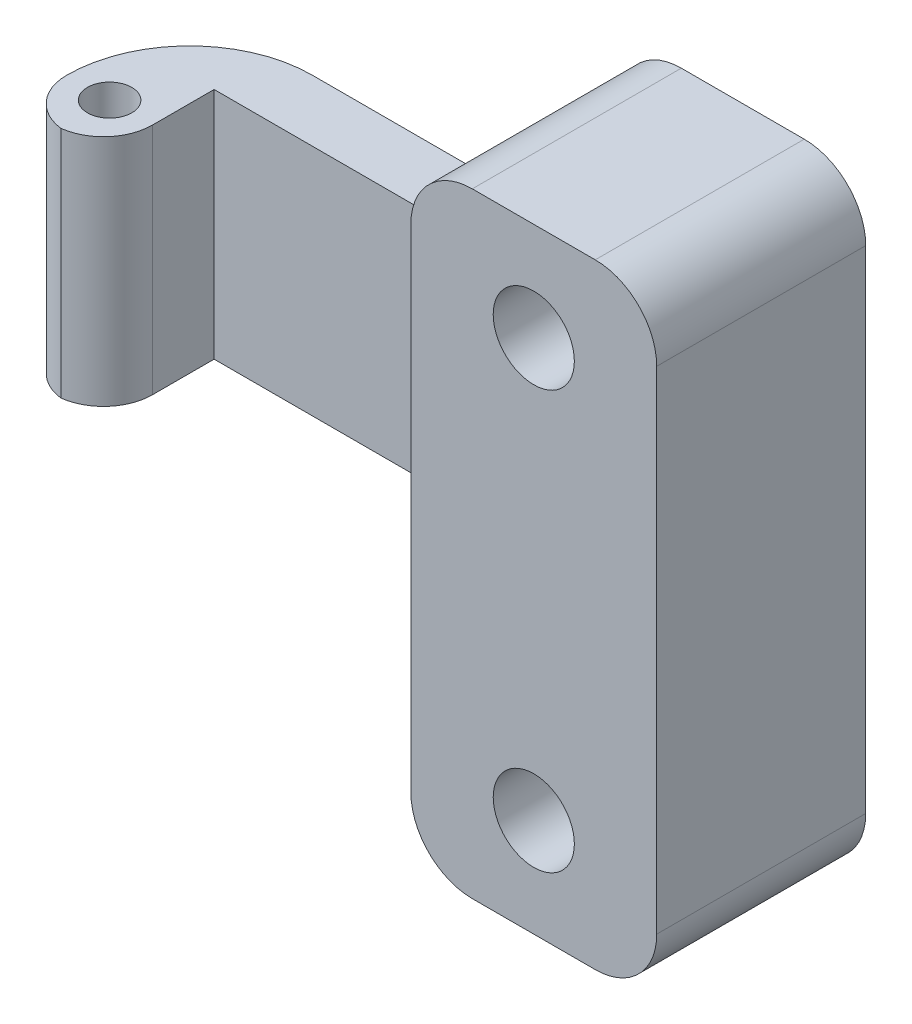
from build123d import *

# Parameters (mm, degrees)
BASE_SKETCH_W           = 35
BASE_SKETCH_H           = 19
BASE_DEPTH              = 5
HINGE_SKETCH_W          = 7
HINGE_SKETCH_H          = 19
HINGE_BODY_DEPTH        = 9
HINGE_HOLE_D            = 3.6
DOOR_BODY_SKETCH_W      = 20
DOOR_BODY_SKETCH_H      = 50
DOOR_BODY_DEPTH         = 12
DOOR_SCREWS_D           = 6.6
DOOR_SCREWS_CBORE_D     = 11
DOOR_SCREWS_CBORE_DEPTH = 6.4
HINGE_ROUND_R           = 3.99
HINGE_BODY_ROUND_R      = 10
DOOR_CORNERS_ROUND_R    = 5
DOOR_BODY_LINE_R        = 3


with BuildPart() as part:
    # Base sketch → Base (new body)
    with BuildSketch(Plane.XY):
        Rectangle(BASE_SKETCH_W, BASE_SKETCH_H)
        Polygon((17.5, 25), (17.5, 9.5), (17.5, -9.5), (17.5, -25), (37.5, -25), (37.5, 25), align=None)
    extrude(amount=BASE_DEPTH)

    # Hinge sketch → Hinge body (add)
    with BuildSketch(Plane.XY.offset(5)):
        with Locations((-14, 0)):
            Rectangle(HINGE_SKETCH_W, HINGE_SKETCH_H)
    extrude(amount=HINGE_BODY_DEPTH)

    # Hinge hole (through all)
    with Locations(Plane(origin=(0, -9.5, 0), x_dir=(-1, 0, 0), z_dir=(0, -1, 0))):
        with Locations((14, -10)):
            Hole(HINGE_HOLE_D / 2)

    # Door body sketch → Door body (add)
    with BuildSketch(Plane.XY.offset(5)):
        with Locations((27.5, 0)):
            Rectangle(DOOR_BODY_SKETCH_W, DOOR_BODY_SKETCH_H)
    extrude(amount=DOOR_BODY_DEPTH)

    # Door screws (through all)
    with Locations(Plane(origin=(0, 0, 0), x_dir=(-1, 0, 0), z_dir=(0, 0, -1))):
        with Locations((-27.5, 17), (-27.5, -17)):
            CounterBoreHole(DOOR_SCREWS_D / 2, DOOR_SCREWS_CBORE_D / 2, DOOR_SCREWS_CBORE_DEPTH)

    # Hinge round
    # the kernel refuses this fillet: 3.99 mm, written as the material it takes off along each edge
    with BuildSketch(Plane(origin=(-17.5, -19.475, 14), x_dir=(0, 0, -1), z_dir=(0, 1, 0)), Plane(origin=(-10.5, 19.475, 14), x_dir=(0, 0, -1), z_dir=(0, -1, 0))) as hinge_round_piece_1:
        with BuildLine():
            CenterArc((HINGE_ROUND_R, -HINGE_ROUND_R), HINGE_ROUND_R, 90, 90)
            Line((0, -HINGE_ROUND_R), (0, 0))
            Line((0, 0), (HINGE_ROUND_R, 0))
        make_face()
    extrude(amount=38.95, mode=Mode.SUBTRACT)

    # Hinge body round
    hinge_body_round_edges = [part.edges().sort_by_distance(p)[0] for p in [
        (-17.5, 0, 0),
    ]]
    fillet(hinge_body_round_edges, radius=HINGE_BODY_ROUND_R)

    # Door corners round
    door_corners_round_edges = [part.edges().sort_by_distance(p)[0] for p in [
        (17.5, 25, 8.5),
        (37.5, 25, 8.5),
        (37.5, -25, 8.5),
        (17.5, -25, 8.5),
    ]]
    fillet(door_corners_round_edges, radius=DOOR_CORNERS_ROUND_R)

    # Door body line
    door_body_line_edges = [part.edges().sort_by_distance(p)[0] for p in [
        (17.5, 9.5, 2.5),
        (17.5, -9.5, 2.5),
    ]]
    fillet(door_body_line_edges, radius=DOOR_BODY_LINE_R)


solid = part.part
